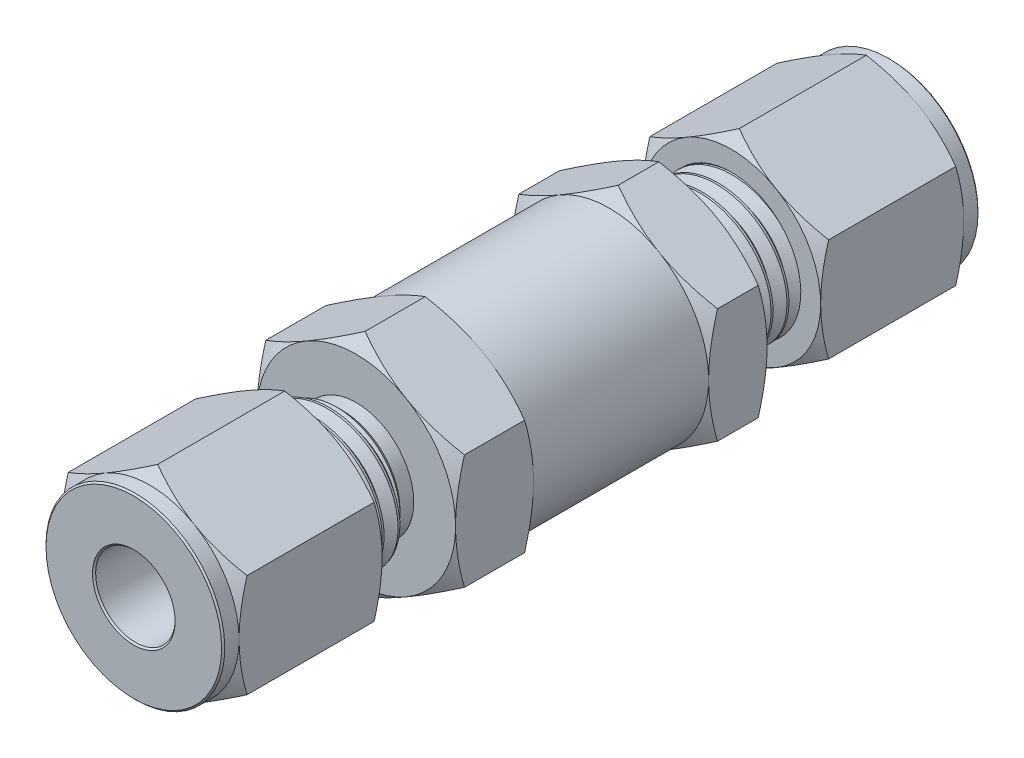
from build123d import *

# Parameters (mm, degrees)
BOSS_EXTRUDE1_DEPTH      = 12.446
BOSS_EXTRUDE1_DEPTH_BACK = 12.446
SKETCH3_R                = 5.55625
BOSS_EXTRUDE2_DEPTH      = 12.7
CUT_SWEEP1_PITCH         = 1.27
CUT_SWEEP1_TO            = 12.7
CIRPATTERN1_COUNT        = 2
BOSS_EXTRUDE3_DEPTH      = 12.7
CHAMFER1_SIZE            = 0.127
CIRPATTERN2_COUNT        = 2


with BuildPart() as part:
    # Sketch2 → Boss-Extrude1 (new, two sides: drawn at the far end of the back side and taken through both)
    with BuildSketch(Plane.XY.offset(-BOSS_EXTRUDE1_DEPTH_BACK)):
        Polygon((0, 9.165435523), (-7.9375, 4.582717762), (-7.9375, -4.582717762), (0, -9.165435523), (7.9375, -4.582717762), (7.9375, 4.582717762), align=None)
    extrude(amount=BOSS_EXTRUDE1_DEPTH + BOSS_EXTRUDE1_DEPTH_BACK)

    # Sketch3 → Boss-Extrude2 (add)
    with BuildSketch(Plane.XY.offset(12.446)):
        Circle(SKETCH3_R)
    boss_extrude2 = extrude(amount=BOSS_EXTRUDE2_DEPTH)

    # Cut-Sweep1: arcs per turn and ends read off the stored shape
    # Cut-Sweep1: the profile of Sketch5 screwed along a right-hand helix through 12 turns, 8 arcs to a turn; built about Z, then put on its axis
    cut_sweep1_z = Axis((0, 0, 0), (0, 0, 1))
    cut_sweep1_corners = [(5.624990766, 0, -2.4209375), (4.731360803, 0, -1.905), (4.731360803, 0, -1.74625), (5.624990766, 0, -1.2303125)]
    with BuildLine(mode=Mode.PRIVATE) as cut_sweep1_profile:
        Line(cut_sweep1_corners[0], cut_sweep1_corners[1])
        Line(cut_sweep1_corners[1], cut_sweep1_corners[2])
        Line(cut_sweep1_corners[2], cut_sweep1_corners[3])
        Line(cut_sweep1_corners[3], cut_sweep1_corners[0])
    cut_sweep1_cap = Face(cut_sweep1_profile.wire())
    cut_sweep1_turn_angles = [0, 22.5, 45, 67.5, 90, 112.5, 135, 157.5, 180, 202.5, 225, 247.5, 270, 292.5, 315, 337.5, 360]
    cut_sweep1_turn_weights = [1, 0.9238795325112867, 1, 0.9238795325112867, 1, 0.9238795325112867, 1, 0.9238795325112867, 1, 0.9238795325112867, 1, 0.9238795325112867, 1, 0.9238795325112867, 1, 0.9238795325112867, 1]
    cut_sweep1_turn_rails = [Edge.make_bspline([Vector(p[0], p[1], 0).rotate(cut_sweep1_z, cut_sweep1_turn_angles[k]) / cut_sweep1_turn_weights[k] + Vector(0, 0, p[2] + CUT_SWEEP1_PITCH * cut_sweep1_turn_angles[k] / 360) for k in range(17)], [0, 0, 0, 1, 1, 2, 2, 3, 3, 4, 4, 5, 5, 6, 6, 7, 7, 8, 8, 8], 2, cut_sweep1_turn_weights) for p in cut_sweep1_corners]
    cut_sweep1_turn_sides = [Face.make_surface_from_curves(cut_sweep1_turn_rails[p[0]], cut_sweep1_turn_rails[p[1]]) for p in [(0, 1), (1, 2), (2, 3), (3, 0)]]
    cut_sweep1 = Plane(origin=(0, 0, 25.146), x_dir=(0, 1, 0), z_dir=(0, 0, -1)) * split(Solid(Shell([*[p.moved(Location((0, 0, CUT_SWEEP1_PITCH * i))) for i in range(12) for p in cut_sweep1_turn_sides], cut_sweep1_cap, cut_sweep1_cap.rotate(cut_sweep1_z, 4320).moved(Location((0, 0, CUT_SWEEP1_PITCH * 4320 / 360)))])), bisect_by=Plane.XY.offset(CUT_SWEEP1_TO), keep=Keep.BOTTOM, mode=Mode.PRIVATE)
    add(cut_sweep1, mode=Mode.SUBTRACT)

    # CirPattern1: Boss-Extrude2, Cut-Sweep1 ×2 about axis
    cirpattern1_axis = Axis((0, 10.081979076, 0), (0, -1, 0))
    add([boss_extrude2.rotate(cirpattern1_axis, i * 360 / CIRPATTERN1_COUNT) for i in range(1, CIRPATTERN1_COUNT)])
    add([cut_sweep1.rotate(cirpattern1_axis, i * 360 / CIRPATTERN1_COUNT) for i in range(1, CIRPATTERN1_COUNT)], mode=Mode.SUBTRACT)

    # Sketch6 → Cut-Revolve1 (revolve, cut)
    with BuildSketch(Plane(origin=(0, 0, 0), x_dir=(0, 0, -1), z_dir=(1, 0, 0)), mode=Mode.PRIVATE) as cut_revolve1_sk:
        Polygon((-12.446, 7.9375), (-12.446, 9.165435523), (-11.737051095, 9.165435523), align=None)
        Polygon((12.446, 7.9375), (12.446, 9.165435523), (11.737051095, 9.165435523), align=None)
        Polygon((-6.931948905, 9.165435523), (-6.223, 7.9375), (7.77875, 7.9375), (8.487698905, 9.165435523), (7.77875, 9.165435523), (-6.223, 9.165435523), align=None)
        Polygon((-30.226, 3.175), (-14.986, 3.175), (-14.986, 2.3749), (14.986, 2.3749), (14.986, 3.175), (30.226, 3.175), (30.226, 0), (-30.226, 0), align=None)
        Polygon((-25.146, 5.693731533), (-25.146, 4.59387927), (-24.046147737, 5.693731533), align=None)
        Polygon((-12.446, 5.693731533), (-14.645704526, 5.693731533), (-13.545852263, 4.59387927), (-12.446, 4.59387927), align=None)
        Polygon((12.446, 4.59387927), (12.446, 5.693731533), (14.645704526, 5.693731533), (13.545852263, 4.59387927), align=None)
        Polygon((24.046147737, 5.693731533), (25.146, 5.693731533), (25.146, 4.59387927), align=None)
    revolve(cut_revolve1_sk.sketch.rotate(Axis((0, 0, 30.226), (0, 0, -1)), 90), axis=Axis((0, 0, 30.226), (0, 0, -1)), mode=Mode.SUBTRACT)


with BuildPart() as body_2:
    # Sketch7 → Boss-Extrude3 (new body)
    with BuildSketch(Plane.XY.offset(30.226)):
        Polygon((0, 8.248891971), (-7.14375, 4.124445986), (-7.14375, -4.124445986), (0, -8.248891971), (7.14375, -4.124445986), (7.14375, 4.124445986), align=None)
    extrude(amount=-BOSS_EXTRUDE3_DEPTH)

    # Sketch8 → Cut-Revolve2 (revolve, cut)
    with BuildSketch(Plane(origin=(0, 0, 0), x_dir=(0, 0, -1), z_dir=(1, 0, 0)), mode=Mode.PRIVATE) as cut_revolve2_sk:
        Polygon((-30.226, 8.248891971), (-30.226, 7.14375), (-28.956, 7.14375), (-28.317945986, 8.248891971), (-28.956, 8.248891971), align=None)
        Polygon((-17.526, 8.248891971), (-17.526, 7.14375), (-18.164054014, 8.248891971), align=None)
        Polygon((-30.226, 3.175), (-25.146, 3.175), (-25.146, 5.55625), (-17.526, 5.55625), (-17.526, 0), (-30.226, 0), align=None)
    revolve(cut_revolve2_sk.sketch.rotate(Axis((0, 0, 30.226), (0, 0, -1)), 180), axis=Axis((0, 0, 30.226), (0, 0, -1)), mode=Mode.SUBTRACT)

    # Chamfer1
    chamfer1_edges = [body_2.edges().sort_by_distance(p)[0] for p in [
        (0, 3.175, 30.226),
        (0, 3.175, 25.146),
        (0, 7.14375, 30.226),
    ]]
    chamfer(chamfer1_edges, length=CHAMFER1_SIZE)


with BuildPart() as cirpattern2_1:
    # CirPattern2: pattern copy
    add(body_2.part.rotate(Axis((0, 0, 0), (0, 1, 0)), 1 * 360 / CIRPATTERN2_COUNT))


solid = Compound([part.part, body_2.part, cirpattern2_1.part])
